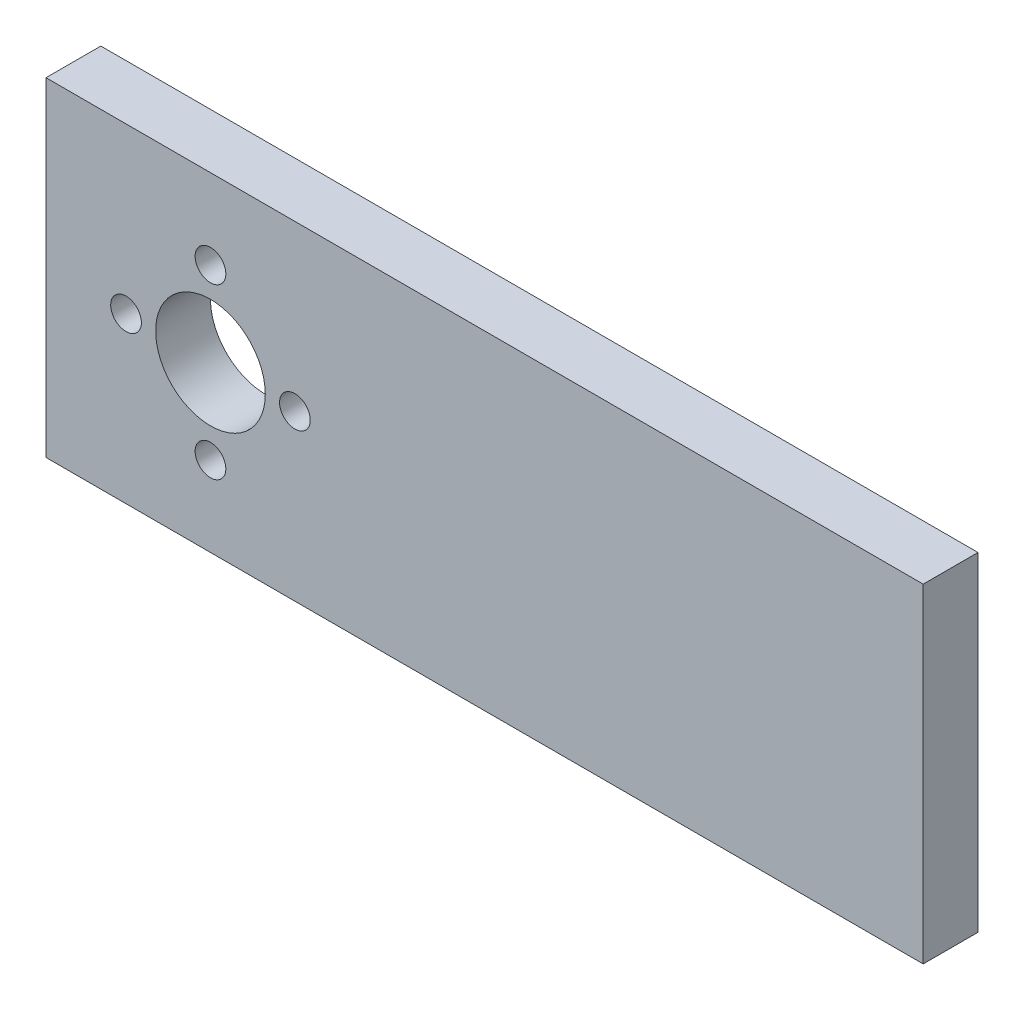
from build123d import *

# Parameters (mm, degrees)
SKETCH1_W           = 101.6
SKETCH1_H           = 38.1
BOSS_EXTRUDE1_DEPTH = 6.35
SKETCH2_R           = 6.35
CUT_EXTRUDE1_DEPTH  = 6.35
SKETCH3_R           = 1.778
CUT_EXTRUDE2_DEPTH  = 6.35
CIRPATTERN1_COUNT   = 4


with BuildPart() as part:
    # Sketch1 → Boss-Extrude1 (new body)
    with BuildSketch(Plane.XY):
        with Locations((50.8, -19.05)):
            Rectangle(SKETCH1_W, SKETCH1_H)
    extrude(amount=BOSS_EXTRUDE1_DEPTH)

    # Sketch2 → Cut-Extrude1 (cut)
    with BuildSketch(Plane.XY.offset(6.35)):
        with Locations((19.05, -19.05)):
            Circle(SKETCH2_R)
    extrude(amount=-CUT_EXTRUDE1_DEPTH, mode=Mode.SUBTRACT)

    # Sketch3 → Cut-Extrude2 (cut)
    with BuildSketch(Plane.XY.offset(6.35)):
        with Locations((19.05, -28.829)):
            Circle(SKETCH3_R)
    cut_extrude2 = extrude(amount=-CUT_EXTRUDE2_DEPTH, mode=Mode.SUBTRACT)

    # CirPattern1: Cut-Extrude2 ×4 about axis
    cirpattern1_axis = Axis((19.05, -19.05, 6.35), (0, 0, 1))
    for i in range(1, CIRPATTERN1_COUNT):
        add(cut_extrude2.rotate(cirpattern1_axis, i * 360 / CIRPATTERN1_COUNT), mode=Mode.SUBTRACT)


solid = part.part
